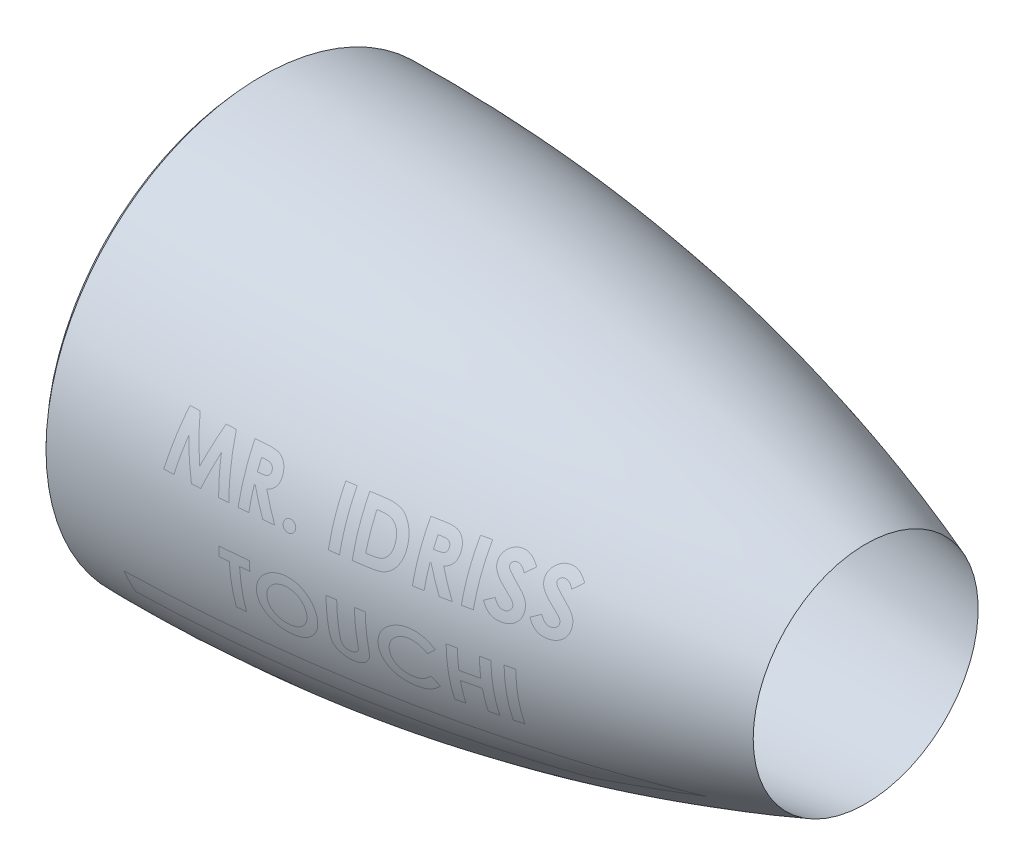
from build123d import *

# Parameters (mm, degrees)
THICKEN1_T2 = 5


with BuildPart() as body_1:
    # Surface-Revolve1: a surface, the sketch's curves turned about an axis
    with BuildLine(Plane.XY, mode=Mode.PRIVATE) as surface_revolve1_1_path:
        Line((0, 180), (25, 180))
        Line((25, 180), (25, 190))
        Line((25, 190), (50, 190))
        Line((50, 190), (580, 108))
        add(Edge.make_bspline(
            [(580, 108), (297.488483172, 211.384065194), (0, 206.970044984)],
            knots=[0, 0, 0, 1, 1, 1], degree=2))
        add(Edge.make_bspline(
            [(0, 206.970044984), (-16.53873794, 191.542064083), (0, 180)],
            knots=[0, 0, 0, 1, 1, 1], degree=2))
    surface_revolve1_1 = Shell.revolve(surface_revolve1_1_path.wire(), 360, Axis((675.575620767, 0, 0), (-1, 0, 0)))
    add(Solid.thicken(surface_revolve1_1, -THICKEN1_T2))


solid = body_1.part
